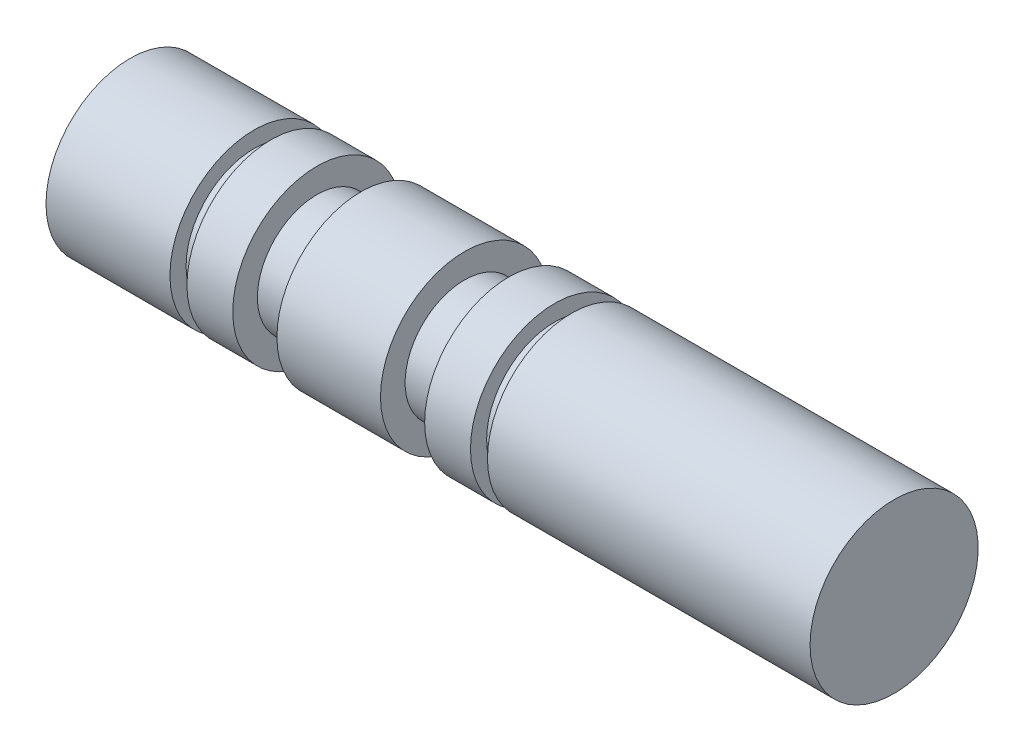
from build123d import *

# Parameters (mm, degrees)
SKETCH_1_R          = 4.95
EXTRUDE_1_DEPTH     = 45
CUT_EXTRUDE_START   = 11
SKETCH_1_3_R        = 4.95
SKETCH_1_3_R_2      = 3.5
CUT_EXTRUDE_1_DEPTH = 2.6
CUT_EXTRUDE_START_2 = 19.7
SKETCH_1_4_R        = 4.95
SKETCH_1_4_R_2      = 3.5
CUT_EXTRUDE_2_DEPTH = 2.6
SKETCH_2_R          = 2
CUT_EXTRUDE_3_DEPTH = 10
SKETCH_3_R          = 1.25
CUT_EXTRUDE_4_DEPTH = 46.541245042
CUT_EXTRUDE_START_3 = -7.3
SKETCH_4_R          = 4.95
SKETCH_4_R_2        = 4
CUT_EXTRUDE_5_DEPTH = 1
CUT_EXTRUDE_START_4 = -25
SKETCH_4_2_R        = 4.95
SKETCH_4_2_R_2      = 4
CUT_EXTRUDE_6_DEPTH = 1


with BuildPart() as part:
    # Эскиз1 → Бобышка-Вытянуть1 (new body)
    with BuildSketch(Plane(origin=(0, 0, 0), x_dir=(0, 0, -1), z_dir=(1, 0, 0))):
        Circle(SKETCH_1_R)
    extrude(amount=EXTRUDE_1_DEPTH)

    # Эскиз1<3> → Вырез-Вытянуть1 (cut)
    with BuildSketch(Plane(origin=(0, 0, 0), x_dir=(0, 0, -1), z_dir=(1, 0, 0)).offset(CUT_EXTRUDE_START)):
        Circle(SKETCH_1_3_R)
        Circle(SKETCH_1_3_R_2, mode=Mode.SUBTRACT)
    extrude(amount=CUT_EXTRUDE_1_DEPTH, mode=Mode.SUBTRACT)

    # Эскиз1<4> → Вырез-Вытянуть2 (cut)
    with BuildSketch(Plane(origin=(0, 0, 0), x_dir=(0, 0, -1), z_dir=(1, 0, 0)).offset(CUT_EXTRUDE_START_2)):
        Circle(SKETCH_1_4_R)
        Circle(SKETCH_1_4_R_2, mode=Mode.SUBTRACT)
    extrude(amount=CUT_EXTRUDE_2_DEPTH, mode=Mode.SUBTRACT)

    # Эскиз2 → Вырез-Вытянуть3 (cut)
    with BuildSketch(Plane.ZY):
        Circle(SKETCH_2_R)
    extrude(amount=-CUT_EXTRUDE_3_DEPTH, mode=Mode.SUBTRACT)

    # Эскиз3 → Вырез-Вытянуть4 (cut, through all)
    with BuildSketch(Plane(origin=(0, 0, 0), x_dir=(1, 0, 0), z_dir=(0, 1, 0))):
        with Locations((4, 0)):
            Circle(SKETCH_3_R)
    extrude(amount=-CUT_EXTRUDE_4_DEPTH, mode=Mode.SUBTRACT)

    # Эскиз4 → Вырез-Вытянуть5 (cut)
    with BuildSketch(Plane.ZY.offset(CUT_EXTRUDE_START_3)):
        Circle(SKETCH_4_R)
        Circle(SKETCH_4_R_2, mode=Mode.SUBTRACT)
    extrude(amount=-CUT_EXTRUDE_5_DEPTH, mode=Mode.SUBTRACT)

    # Эскиз4<2> → Вырез-Вытянуть6 (cut)
    with BuildSketch(Plane.ZY.offset(CUT_EXTRUDE_START_4)):
        Circle(SKETCH_4_2_R)
        Circle(SKETCH_4_2_R_2, mode=Mode.SUBTRACT)
    extrude(amount=-CUT_EXTRUDE_6_DEPTH, mode=Mode.SUBTRACT)


solid = part.part
